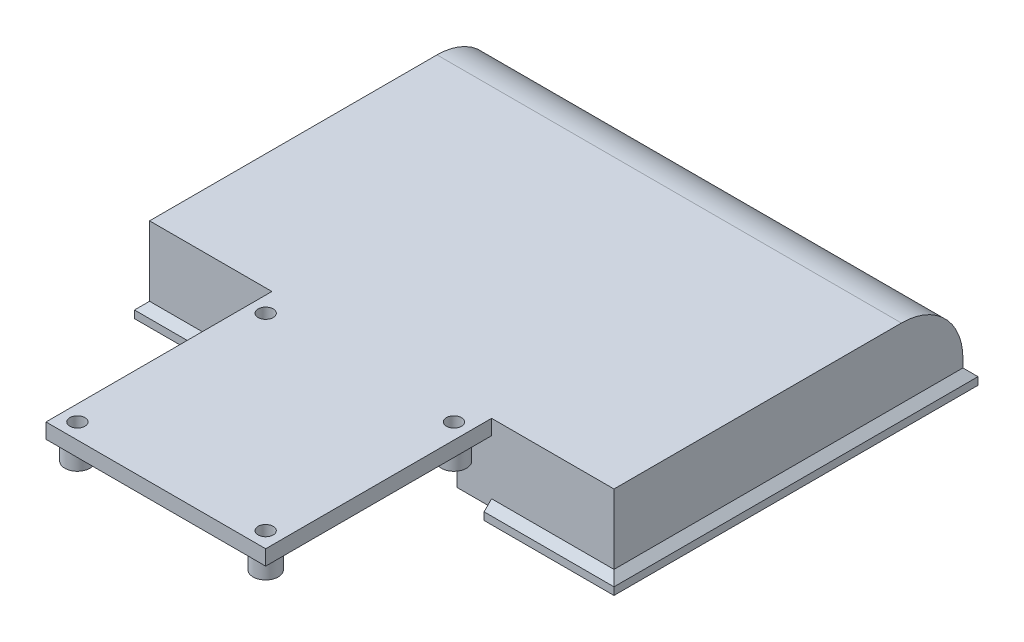
from build123d import *

# Parameters (mm, degrees)
BODY_DEPTH              = 70.053212
BODY_DEPTH_BACK         = 3.946788
SHELL1_T                = -1.2
SKETCH7_W               = 74
SKETCH7_H               = 1.6
BACK_WALL_DEPTH         = 12.3
SKETCH8_W               = 35
SKETCH8_H               = 2.4
FAN_MOUNT_DEPTH         = 36
SKETCH12_R              = 2
FAN_BOSS_DEPTH          = 3
M2_CLEARANCE_HOLE2_D    = 2.4
EDGE_START              = -2
EDGE_FLANGE_OUTLINE_W   = 76.399999565
EDGE_FLANGE_OUTLINE_H   = 58
EDGE_FLANGE_OUTLINE_W_2 = 74
EDGE_FLANGE_OUTLINE_H_2 = 55.6
EDGE_FLANGE_DEPTH       = 3.2
CHAMFER1_SIZE           = 2
SKETCH18_W              = 74.39999908
SKETCH18_H              = 56
BOX_RECESS_DEPTH        = 1.2
FAN_OPENING_REACH       = 93.419
SKETCH15_W              = 24
SKETCH15_H              = 8
SKETCH19_W              = 35
SKETCH19_H              = 2.4
FAN_RELIEF_DEPTH        = 92.419014649
AIR_CHANNEL_REACH       = 362.234
SKETCH20_W              = 6
SKETCH20_H              = 2.4
CLIP_RELIEF_DEPTH       = 1.6
LPATTERN2_COUNT         = 3
LPATTERN2_PITCH         = 21.6


# Read off the part's stored shape, not the designer's step: edge flange
with BuildPart() as part:
    # Sketch1 → body (new, two sides: drawn at the far end of the back side and taken through both)
    with BuildSketch(Plane(origin=(0, 0, 0), x_dir=(0, 0, -1), z_dir=(1, 0, 0)).offset(-BODY_DEPTH_BACK)):
        with BuildLine():
            Line((-316.902840602, -4.939561402), (-261.302840602, -4.939561402))
            Line((-261.302840602, -4.939561402), (-261.302840602, -2.439561402))
            ThreePointArc((-261.302840602, -2.439561402), (-264.173194146, 4.490085054), (-271.102840602, 7.360438598))
            Line((-271.102840602, 7.360438598), (-316.902840602, 7.360438598))
            Line((-316.902840602, 7.360438598), (-316.902840602, -4.939561402))
        make_face()
    extrude(amount=BODY_DEPTH + BODY_DEPTH_BACK)

    # Shell1
    shell1_openings = [part.faces().sort_by_distance(p)[0] for p in [
        (33.053212, -4.939561402, 289.102840602),
        (33.053212, 1.210438598, 316.902840602),
    ]]
    offset(amount=SHELL1_T, openings=shell1_openings, kind=Kind.INTERSECTION)

    # Sketch7 → back wall (add)
    with BuildSketch(Plane(origin=(0, -4.939561402, 0), x_dir=(1, 0, 0), z_dir=(0, 1, 0))):
        with Locations((33.053212174, -316.102840602)):
            Rectangle(SKETCH7_W, SKETCH7_H)
    extrude(amount=BACK_WALL_DEPTH)

    # Sketch8 → fan mount (add)
    with BuildSketch(Plane(origin=(0, 0, 316.902840602), x_dir=(-1, 0, 0), z_dir=(0, 0, -1))):
        with Locations((-33.053212174, 6.160438598)):
            Rectangle(SKETCH8_W, SKETCH8_H)
    extrude(amount=-FAN_MOUNT_DEPTH)

    # Sketch12 → fan boss (add)
    with BuildSketch(Plane.XZ.offset(-4.960438598)):
        with Locations((18.053212174, 350.402840602)):
            Circle(SKETCH12_R)
        with Locations(Location((18.053212174, 320.402840602, 0), (0, 0, 180))):
            Circle(SKETCH12_R)
        with Locations(Location((48.053212174, 350.402840602, 0), (0, 0, 180))):
            Circle(SKETCH12_R)
        with Locations((48.053212174, 320.402840602)):
            Circle(SKETCH12_R)
    extrude(amount=FAN_BOSS_DEPTH)

    # M2 Clearance Hole2 (through all)
    with Locations(Plane(origin=(0, 1.960438598, 0), x_dir=(-1, 0, 0), z_dir=(0, -1, 0))):
        with Locations((-18.053212174, -320.402840602), (-18.053212174, -350.402840602), (-48.053212174, -350.402840602), (-48.053212174, -320.402840602)):
            Hole(M2_CLEARANCE_HOLE2_D / 2)

    # edge flange outline → edge flange (add)
    with BuildSketch(Plane.XZ.offset(4.939561402).offset(EDGE_START)):
        with Locations((33.053211957, 289.102840602)):
            Rectangle(EDGE_FLANGE_OUTLINE_W, EDGE_FLANGE_OUTLINE_H)
        with Locations((33.053212174, 289.102840602)):
            Rectangle(EDGE_FLANGE_OUTLINE_W_2, EDGE_FLANGE_OUTLINE_H_2, mode=Mode.SUBTRACT)
    extrude(amount=EDGE_FLANGE_DEPTH)

    # Chamfer1
    # the kernel refuses this chamfer: 2 mm, written as the material it takes off along each edge
    with BuildSketch(Plane(origin=(76.396577715, -2.939561402, 318.102840602), x_dir=(0, 0.027495876610586605, -0.9996219169112968), z_dir=(-1, 0, 0))) as chamfer1_piece_1_section:
        Polygon((CHAMFER1_SIZE * 0.999621916911, CHAMFER1_SIZE * 0.0274958766106), (-CHAMFER1_SIZE * 0.0274958766106, CHAMFER1_SIZE * 0.999621916911), (0, 0), align=None)
    chamfer1_piece_1 = extrude(amount=86.686731517, mode=Mode.PRIVATE)
    chamfer1_piece_1 = split(chamfer1_piece_1, bisect_by=Plane(origin=(70.053212, -3.160856778, 316.605391079), z_dir=(1, 0, 0)), keep=Keep.TOP, mode=Mode.PRIVATE)
    chamfer1_piece_1 = split(chamfer1_piece_1, bisect_by=Plane(origin=(73.224894857, -3.160856778, 316.902840602), z_dir=(0, 0, -1)), keep=Keep.TOP, mode=Mode.PRIVATE)
    add(chamfer1_piece_1, mode=Mode.SUBTRACT)
    with BuildSketch(Plane(origin=(76.396577715, -2.939561402, 318.102840602), x_dir=(0, 0.027495876610586605, -0.9996219169112968), z_dir=(-1, 0, 0))) as chamfer1_piece_2_section:
        Polygon((CHAMFER1_SIZE * 0.999621916911, CHAMFER1_SIZE * 0.0274958766106), (-CHAMFER1_SIZE * 0.0274958766106, CHAMFER1_SIZE * 0.999621916911), (0, 0), align=None)
    chamfer1_piece_2 = extrude(amount=86.686731517, mode=Mode.PRIVATE)
    chamfer1_piece_2 = split(chamfer1_piece_2, bisect_by=Plane(origin=(70.053212, -3.689580321, 317.616127372), z_dir=(1, 0, 0)), keep=Keep.TOP, mode=Mode.PRIVATE)
    chamfer1_piece_2 = split(chamfer1_piece_2, bisect_by=Plane(origin=(73.224894857, -3.689580321, 316.902840602), z_dir=(0, 0, 1)), keep=Keep.TOP, mode=Mode.PRIVATE)
    add(chamfer1_piece_2, mode=Mode.SUBTRACT)
    with BuildSketch(Plane(origin=(76.396577715, -2.939561402, 318.102840602), x_dir=(0, 0.027495876610586605, -0.9996219169112968), z_dir=(-1, 0, 0))) as chamfer1_piece_3_section:
        Polygon((CHAMFER1_SIZE * 0.999621916911, CHAMFER1_SIZE * 0.0274958766106), (-CHAMFER1_SIZE * 0.0274958766106, CHAMFER1_SIZE * 0.999621916911), (0, 0), align=None)
    chamfer1_piece_3 = extrude(amount=86.686731517, mode=Mode.PRIVATE)
    chamfer1_piece_3 = split(chamfer1_piece_3, bisect_by=Plane(origin=(70.053212, -3.689580321, 317.616127372), z_dir=(-1, 0, 0)), keep=Keep.TOP, mode=Mode.PRIVATE)
    chamfer1_piece_3 = split(chamfer1_piece_3, bisect_by=Plane(origin=(-3.946788, -3.689580321, 317.616127372), z_dir=(1, 0, 0)), keep=Keep.TOP, mode=Mode.PRIVATE)
    chamfer1_piece_3 = split(chamfer1_piece_3, bisect_by=Plane(origin=(33.053212, -3.689580321, 316.902840602), z_dir=(0, 0, 1)), keep=Keep.TOP, mode=Mode.PRIVATE)
    add(chamfer1_piece_3, mode=Mode.SUBTRACT)
    with BuildSketch(Plane(origin=(76.396577715, -2.939561402, 318.102840602), x_dir=(0, 0.027495876610586605, -0.9996219169112968), z_dir=(-1, 0, 0))) as chamfer1_piece_4_section:
        Polygon((CHAMFER1_SIZE * 0.999621916911, CHAMFER1_SIZE * 0.0274958766106), (-CHAMFER1_SIZE * 0.0274958766106, CHAMFER1_SIZE * 0.999621916911), (0, 0), align=None)
    chamfer1_piece_4 = extrude(amount=86.686731517, mode=Mode.PRIVATE)
    chamfer1_piece_4 = split(chamfer1_piece_4, bisect_by=Plane(origin=(-3.946788, -3.160856778, 316.605391079), z_dir=(-1, 0, 0)), keep=Keep.TOP, mode=Mode.PRIVATE)
    chamfer1_piece_4 = split(chamfer1_piece_4, bisect_by=Plane(origin=(-7.118470901, -3.160856778, 316.902840602), z_dir=(0, 0, -1)), keep=Keep.TOP, mode=Mode.PRIVATE)
    add(chamfer1_piece_4, mode=Mode.SUBTRACT)
    with BuildSketch(Plane(origin=(76.396577715, -2.939561402, 318.102840602), x_dir=(0, 0.027495876610586605, -0.9996219169112968), z_dir=(-1, 0, 0))) as chamfer1_piece_5_section:
        Polygon((CHAMFER1_SIZE * 0.999621916911, CHAMFER1_SIZE * 0.0274958766106), (-CHAMFER1_SIZE * 0.0274958766106, CHAMFER1_SIZE * 0.999621916911), (0, 0), align=None)
    chamfer1_piece_5 = extrude(amount=86.686731517, mode=Mode.PRIVATE)
    chamfer1_piece_5 = split(chamfer1_piece_5, bisect_by=Plane(origin=(-3.946788, -3.689580321, 317.616127372), z_dir=(-1, 0, 0)), keep=Keep.TOP, mode=Mode.PRIVATE)
    chamfer1_piece_5 = split(chamfer1_piece_5, bisect_by=Plane(origin=(-7.118470901, -3.689580321, 316.902840602), z_dir=(0, 0, 1)), keep=Keep.TOP, mode=Mode.PRIVATE)
    add(chamfer1_piece_5, mode=Mode.SUBTRACT)
    with BuildSketch(Plane(origin=(71.253211739, -2.939561402, 254.959474626), x_dir=(-0.9996219169112968, 0.0274958766105862, 0), z_dir=(0, 0, 1))) as chamfer1_piece_6_section:
        Polygon((CHAMFER1_SIZE * 0.999621916911, CHAMFER1_SIZE * 0.0274958766106), (-CHAMFER1_SIZE * 0.0274958766106, CHAMFER1_SIZE * 0.999621916911), (0, 0), align=None)
    chamfer1_piece_6 = extrude(amount=68.286731952, mode=Mode.PRIVATE)
    chamfer1_piece_6 = split(chamfer1_piece_6, bisect_by=Plane(origin=(70.053212, -3.160856869, 258.131157614), z_dir=(-1, 0, 0)), keep=Keep.TOP, mode=Mode.PRIVATE)
    chamfer1_piece_6 = split(chamfer1_piece_6, bisect_by=Plane(origin=(69.75576239, -3.160856869, 261.302840602), z_dir=(0, 0, -1)), keep=Keep.TOP, mode=Mode.PRIVATE)
    add(chamfer1_piece_6, mode=Mode.SUBTRACT)
    with BuildSketch(Plane(origin=(71.253211739, -2.939561402, 254.959474626), x_dir=(-0.9996219169112968, 0.0274958766105862, 0), z_dir=(0, 0, 1))) as chamfer1_piece_7_section:
        Polygon((CHAMFER1_SIZE * 0.999621916911, CHAMFER1_SIZE * 0.0274958766106), (-CHAMFER1_SIZE * 0.0274958766106, CHAMFER1_SIZE * 0.999621916911), (0, 0), align=None)
    chamfer1_piece_7 = extrude(amount=68.286731952, mode=Mode.PRIVATE)
    chamfer1_piece_7 = split(chamfer1_piece_7, bisect_by=Plane(origin=(70.053212, -3.689580366, 258.131157614), z_dir=(1, 0, 0)), keep=Keep.TOP, mode=Mode.PRIVATE)
    chamfer1_piece_7 = split(chamfer1_piece_7, bisect_by=Plane(origin=(70.766498595, -3.689580366, 261.302840602), z_dir=(0, 0, -1)), keep=Keep.TOP, mode=Mode.PRIVATE)
    add(chamfer1_piece_7, mode=Mode.SUBTRACT)
    with BuildSketch(Plane(origin=(71.253211739, -2.939561402, 254.959474626), x_dir=(-0.9996219169112968, 0.0274958766105862, 0), z_dir=(0, 0, 1))) as chamfer1_piece_8_section:
        Polygon((CHAMFER1_SIZE * 0.999621916911, CHAMFER1_SIZE * 0.0274958766106), (-CHAMFER1_SIZE * 0.0274958766106, CHAMFER1_SIZE * 0.999621916911), (0, 0), align=None)
    chamfer1_piece_8 = extrude(amount=68.286731952, mode=Mode.PRIVATE)
    chamfer1_piece_8 = split(chamfer1_piece_8, bisect_by=Plane(origin=(70.053212, -3.689580366, 289.102840602), z_dir=(1, 0, 0)), keep=Keep.TOP, mode=Mode.PRIVATE)
    chamfer1_piece_8 = split(chamfer1_piece_8, bisect_by=Plane(origin=(70.766498595, -3.689580366, 316.902840602), z_dir=(0, 0, -1)), keep=Keep.TOP, mode=Mode.PRIVATE)
    chamfer1_piece_8 = split(chamfer1_piece_8, bisect_by=Plane(origin=(70.766498595, -3.689580366, 261.302840602), z_dir=(0, 0, 1)), keep=Keep.TOP, mode=Mode.PRIVATE)
    add(chamfer1_piece_8, mode=Mode.SUBTRACT)
    with BuildSketch(Plane(origin=(71.253211739, -2.939561402, 254.959474626), x_dir=(-0.9996219169112968, 0.0274958766105862, 0), z_dir=(0, 0, 1))) as chamfer1_piece_9_section:
        Polygon((CHAMFER1_SIZE * 0.999621916911, CHAMFER1_SIZE * 0.0274958766106), (-CHAMFER1_SIZE * 0.0274958766106, CHAMFER1_SIZE * 0.999621916911), (0, 0), align=None)
    chamfer1_piece_9 = extrude(amount=68.286731952, mode=Mode.PRIVATE)
    chamfer1_piece_9 = split(chamfer1_piece_9, bisect_by=Plane(origin=(70.053212, -3.160856869, 320.07452359), z_dir=(-1, 0, 0)), keep=Keep.TOP, mode=Mode.PRIVATE)
    chamfer1_piece_9 = split(chamfer1_piece_9, bisect_by=Plane(origin=(69.75576239, -3.160856869, 316.902840602), z_dir=(0, 0, 1)), keep=Keep.TOP, mode=Mode.PRIVATE)
    add(chamfer1_piece_9, mode=Mode.SUBTRACT)
    with BuildSketch(Plane(origin=(71.253211739, -2.939561402, 254.959474626), x_dir=(-0.9996219169112968, 0.0274958766105862, 0), z_dir=(0, 0, 1))) as chamfer1_piece_10_section:
        Polygon((CHAMFER1_SIZE * 0.999621916911, CHAMFER1_SIZE * 0.0274958766106), (-CHAMFER1_SIZE * 0.0274958766106, CHAMFER1_SIZE * 0.999621916911), (0, 0), align=None)
    chamfer1_piece_10 = extrude(amount=68.286731952, mode=Mode.PRIVATE)
    chamfer1_piece_10 = split(chamfer1_piece_10, bisect_by=Plane(origin=(70.053212, -3.689580366, 320.07452359), z_dir=(1, 0, 0)), keep=Keep.TOP, mode=Mode.PRIVATE)
    chamfer1_piece_10 = split(chamfer1_piece_10, bisect_by=Plane(origin=(70.766498595, -3.689580366, 316.902840602), z_dir=(0, 0, 1)), keep=Keep.TOP, mode=Mode.PRIVATE)
    add(chamfer1_piece_10, mode=Mode.SUBTRACT)
    with BuildSketch(Plane(origin=(-10.290153802, -2.939561402, 260.102840602), x_dir=(0, 0.027495876610586174, 0.9996219169112968), z_dir=(1, 0, 0))) as chamfer1_piece_11_section:
        Polygon((CHAMFER1_SIZE * 0.999621916911, CHAMFER1_SIZE * 0.0274958766106), (-CHAMFER1_SIZE * 0.0274958766106, CHAMFER1_SIZE * 0.999621916911), (0, 0), align=None)
    chamfer1_piece_11 = extrude(amount=86.686731517, mode=Mode.PRIVATE)
    chamfer1_piece_11 = split(chamfer1_piece_11, bisect_by=Plane(origin=(-3.946788, -3.160856778, 261.600290125), z_dir=(-1, 0, 0)), keep=Keep.TOP, mode=Mode.PRIVATE)
    chamfer1_piece_11 = split(chamfer1_piece_11, bisect_by=Plane(origin=(-7.118470901, -3.160856778, 261.302840602), z_dir=(0, 0, 1)), keep=Keep.TOP, mode=Mode.PRIVATE)
    add(chamfer1_piece_11, mode=Mode.SUBTRACT)
    with BuildSketch(Plane(origin=(-10.290153802, -2.939561402, 260.102840602), x_dir=(0, 0.027495876610586174, 0.9996219169112968), z_dir=(1, 0, 0))) as chamfer1_piece_12_section:
        Polygon((CHAMFER1_SIZE * 0.999621916911, CHAMFER1_SIZE * 0.0274958766106), (-CHAMFER1_SIZE * 0.0274958766106, CHAMFER1_SIZE * 0.999621916911), (0, 0), align=None)
    chamfer1_piece_12 = extrude(amount=86.686731517, mode=Mode.PRIVATE)
    chamfer1_piece_12 = split(chamfer1_piece_12, bisect_by=Plane(origin=(-3.946788, -3.689580321, 260.589553832), z_dir=(-1, 0, 0)), keep=Keep.TOP, mode=Mode.PRIVATE)
    chamfer1_piece_12 = split(chamfer1_piece_12, bisect_by=Plane(origin=(-7.118470901, -3.689580321, 261.302840602), z_dir=(0, 0, -1)), keep=Keep.TOP, mode=Mode.PRIVATE)
    add(chamfer1_piece_12, mode=Mode.SUBTRACT)
    with BuildSketch(Plane(origin=(-10.290153802, -2.939561402, 260.102840602), x_dir=(0, 0.027495876610586174, 0.9996219169112968), z_dir=(1, 0, 0))) as chamfer1_piece_13_section:
        Polygon((CHAMFER1_SIZE * 0.999621916911, CHAMFER1_SIZE * 0.0274958766106), (-CHAMFER1_SIZE * 0.0274958766106, CHAMFER1_SIZE * 0.999621916911), (0, 0), align=None)
    chamfer1_piece_13 = extrude(amount=86.686731517, mode=Mode.PRIVATE)
    chamfer1_piece_13 = split(chamfer1_piece_13, bisect_by=Plane(origin=(70.053212, -3.689580321, 260.589553832), z_dir=(-1, 0, 0)), keep=Keep.TOP, mode=Mode.PRIVATE)
    chamfer1_piece_13 = split(chamfer1_piece_13, bisect_by=Plane(origin=(-3.946788, -3.689580321, 260.589553832), z_dir=(1, 0, 0)), keep=Keep.TOP, mode=Mode.PRIVATE)
    chamfer1_piece_13 = split(chamfer1_piece_13, bisect_by=Plane(origin=(33.053212, -3.689580321, 261.302840602), z_dir=(0, 0, -1)), keep=Keep.TOP, mode=Mode.PRIVATE)
    add(chamfer1_piece_13, mode=Mode.SUBTRACT)
    with BuildSketch(Plane(origin=(-10.290153802, -2.939561402, 260.102840602), x_dir=(0, 0.027495876610586174, 0.9996219169112968), z_dir=(1, 0, 0))) as chamfer1_piece_14_section:
        Polygon((CHAMFER1_SIZE * 0.999621916911, CHAMFER1_SIZE * 0.0274958766106), (-CHAMFER1_SIZE * 0.0274958766106, CHAMFER1_SIZE * 0.999621916911), (0, 0), align=None)
    chamfer1_piece_14 = extrude(amount=86.686731517, mode=Mode.PRIVATE)
    chamfer1_piece_14 = split(chamfer1_piece_14, bisect_by=Plane(origin=(70.053212, -3.160856778, 261.600290125), z_dir=(1, 0, 0)), keep=Keep.TOP, mode=Mode.PRIVATE)
    chamfer1_piece_14 = split(chamfer1_piece_14, bisect_by=Plane(origin=(73.224894857, -3.160856778, 261.302840602), z_dir=(0, 0, 1)), keep=Keep.TOP, mode=Mode.PRIVATE)
    add(chamfer1_piece_14, mode=Mode.SUBTRACT)
    with BuildSketch(Plane(origin=(-10.290153802, -2.939561402, 260.102840602), x_dir=(0, 0.027495876610586174, 0.9996219169112968), z_dir=(1, 0, 0))) as chamfer1_piece_15_section:
        Polygon((CHAMFER1_SIZE * 0.999621916911, CHAMFER1_SIZE * 0.0274958766106), (-CHAMFER1_SIZE * 0.0274958766106, CHAMFER1_SIZE * 0.999621916911), (0, 0), align=None)
    chamfer1_piece_15 = extrude(amount=86.686731517, mode=Mode.PRIVATE)
    chamfer1_piece_15 = split(chamfer1_piece_15, bisect_by=Plane(origin=(70.053212, -3.689580321, 260.589553832), z_dir=(1, 0, 0)), keep=Keep.TOP, mode=Mode.PRIVATE)
    chamfer1_piece_15 = split(chamfer1_piece_15, bisect_by=Plane(origin=(73.224894857, -3.689580321, 261.302840602), z_dir=(0, 0, -1)), keep=Keep.TOP, mode=Mode.PRIVATE)
    add(chamfer1_piece_15, mode=Mode.SUBTRACT)
    with BuildSketch(Plane(origin=(-5.146787826, -2.939561402, 323.246206578), x_dir=(0.9996219169112968, 0.027495876610586275, 0), z_dir=(0, 0, -1))) as chamfer1_piece_16_section:
        Polygon((CHAMFER1_SIZE * 0.999621916911, CHAMFER1_SIZE * 0.0274958766106), (-CHAMFER1_SIZE * 0.0274958766106, CHAMFER1_SIZE * 0.999621916911), (0, 0), align=None)
    chamfer1_piece_16 = extrude(amount=68.286731952, mode=Mode.PRIVATE)
    chamfer1_piece_16 = split(chamfer1_piece_16, bisect_by=Plane(origin=(-3.946788, -3.160856839, 320.07452359), z_dir=(1, 0, 0)), keep=Keep.TOP, mode=Mode.PRIVATE)
    chamfer1_piece_16 = split(chamfer1_piece_16, bisect_by=Plane(origin=(-3.649338419, -3.160856839, 316.902840602), z_dir=(0, 0, 1)), keep=Keep.TOP, mode=Mode.PRIVATE)
    add(chamfer1_piece_16, mode=Mode.SUBTRACT)
    with BuildSketch(Plane(origin=(-5.146787826, -2.939561402, 323.246206578), x_dir=(0.9996219169112968, 0.027495876610586275, 0), z_dir=(0, 0, -1))) as chamfer1_piece_17_section:
        Polygon((CHAMFER1_SIZE * 0.999621916911, CHAMFER1_SIZE * 0.0274958766106), (-CHAMFER1_SIZE * 0.0274958766106, CHAMFER1_SIZE * 0.999621916911), (0, 0), align=None)
    chamfer1_piece_17 = extrude(amount=68.286731952, mode=Mode.PRIVATE)
    chamfer1_piece_17 = split(chamfer1_piece_17, bisect_by=Plane(origin=(-3.946788, -3.689580351, 320.07452359), z_dir=(-1, 0, 0)), keep=Keep.TOP, mode=Mode.PRIVATE)
    chamfer1_piece_17 = split(chamfer1_piece_17, bisect_by=Plane(origin=(-4.660074654, -3.689580351, 316.902840602), z_dir=(0, 0, 1)), keep=Keep.TOP, mode=Mode.PRIVATE)
    add(chamfer1_piece_17, mode=Mode.SUBTRACT)
    with BuildSketch(Plane(origin=(-5.146787826, -2.939561402, 323.246206578), x_dir=(0.9996219169112968, 0.027495876610586275, 0), z_dir=(0, 0, -1))) as chamfer1_piece_18_section:
        Polygon((CHAMFER1_SIZE * 0.999621916911, CHAMFER1_SIZE * 0.0274958766106), (-CHAMFER1_SIZE * 0.0274958766106, CHAMFER1_SIZE * 0.999621916911), (0, 0), align=None)
    chamfer1_piece_18 = extrude(amount=68.286731952, mode=Mode.PRIVATE)
    chamfer1_piece_18 = split(chamfer1_piece_18, bisect_by=Plane(origin=(-3.946788, -3.689580351, 289.102840602), z_dir=(-1, 0, 0)), keep=Keep.TOP, mode=Mode.PRIVATE)
    chamfer1_piece_18 = split(chamfer1_piece_18, bisect_by=Plane(origin=(-4.660074654, -3.689580351, 316.902840602), z_dir=(0, 0, -1)), keep=Keep.TOP, mode=Mode.PRIVATE)
    chamfer1_piece_18 = split(chamfer1_piece_18, bisect_by=Plane(origin=(-4.660074654, -3.689580351, 261.302840602), z_dir=(0, 0, 1)), keep=Keep.TOP, mode=Mode.PRIVATE)
    add(chamfer1_piece_18, mode=Mode.SUBTRACT)
    with BuildSketch(Plane(origin=(-5.146787826, -2.939561402, 323.246206578), x_dir=(0.9996219169112968, 0.027495876610586275, 0), z_dir=(0, 0, -1))) as chamfer1_piece_19_section:
        Polygon((CHAMFER1_SIZE * 0.999621916911, CHAMFER1_SIZE * 0.0274958766106), (-CHAMFER1_SIZE * 0.0274958766106, CHAMFER1_SIZE * 0.999621916911), (0, 0), align=None)
    chamfer1_piece_19 = extrude(amount=68.286731952, mode=Mode.PRIVATE)
    chamfer1_piece_19 = split(chamfer1_piece_19, bisect_by=Plane(origin=(-3.946788, -3.160856839, 258.131157614), z_dir=(1, 0, 0)), keep=Keep.TOP, mode=Mode.PRIVATE)
    chamfer1_piece_19 = split(chamfer1_piece_19, bisect_by=Plane(origin=(-3.649338419, -3.160856839, 261.302840602), z_dir=(0, 0, -1)), keep=Keep.TOP, mode=Mode.PRIVATE)
    add(chamfer1_piece_19, mode=Mode.SUBTRACT)
    with BuildSketch(Plane(origin=(-5.146787826, -2.939561402, 323.246206578), x_dir=(0.9996219169112968, 0.027495876610586275, 0), z_dir=(0, 0, -1))) as chamfer1_piece_20_section:
        Polygon((CHAMFER1_SIZE * 0.999621916911, CHAMFER1_SIZE * 0.0274958766106), (-CHAMFER1_SIZE * 0.0274958766106, CHAMFER1_SIZE * 0.999621916911), (0, 0), align=None)
    chamfer1_piece_20 = extrude(amount=68.286731952, mode=Mode.PRIVATE)
    chamfer1_piece_20 = split(chamfer1_piece_20, bisect_by=Plane(origin=(-3.946788, -3.689580351, 258.131157614), z_dir=(-1, 0, 0)), keep=Keep.TOP, mode=Mode.PRIVATE)
    chamfer1_piece_20 = split(chamfer1_piece_20, bisect_by=Plane(origin=(-4.660074654, -3.689580351, 261.302840602), z_dir=(0, 0, -1)), keep=Keep.TOP, mode=Mode.PRIVATE)
    add(chamfer1_piece_20, mode=Mode.SUBTRACT)

    # Sketch18 → box recess (cut)
    with BuildSketch(Plane(origin=(0, -6.139561402, 0), x_dir=(-1, 0, 0), z_dir=(0, -1, 0))):
        with Locations((-33.053212726, -289.102840602)):
            Rectangle(SKETCH18_W, SKETCH18_H)
    extrude(amount=-BOX_RECESS_DEPTH, mode=Mode.SUBTRACT)

    # Sketch15 → fan opening (cut, up to next)
    with BuildSketch(Plane.XY.offset(316.902840602), mode=Mode.PRIVATE) as fan_opening_sk1:
        with Locations((33.053212174, -0.939561402)):
            Rectangle(SKETCH15_W, SKETCH15_H)
    fan_opening_tool1 = extrude(fan_opening_sk1.sketch, amount=-FAN_OPENING_REACH, mode=Mode.PRIVATE) & part.part
    add(fan_opening_tool1.solids().sort_by_distance((33.053212, -0.939561, 316.902841))[0], mode=Mode.SUBTRACT)

    # Sketch19 → fan relief (cut, through all)
    with BuildSketch(Plane.XY.offset(316.902840602)):
        with Locations((33.053212174, -4.939561402)):
            Rectangle(SKETCH19_W, SKETCH19_H)
    extrude(amount=FAN_RELIEF_DEPTH, mode=Mode.SUBTRACT)

    # Sketch16 → air channel (add, up to next)
    with BuildSketch(Plane.XZ.offset(4.939561402), mode=Mode.PRIVATE) as air_channel_sk1:
        with BuildLine():
            Line((62.453212174, 261.102840602), (62.453212174, 291.102840602))
            ThreePointArc((62.453212174, 291.102840602), (54.653212174, 298.902840602), (46.853212174, 291.102840602))
            Line((46.853212174, 291.102840602), (46.853212174, 261.102840602))
            Line((46.853212174, 261.102840602), (62.453212174, 261.102840602))
        make_face()
        with BuildLine():
            Line((48.053212174, 262.302840602), (61.253212174, 262.302840602))
            Line((61.253212174, 262.302840602), (61.253212174, 291.102840602))
            ThreePointArc((61.253212174, 291.102840602), (54.653212174, 297.702840602), (48.053212174, 291.102840602))
            Line((48.053212174, 291.102840602), (48.053212174, 262.302840602))
        make_face(mode=Mode.SUBTRACT)
    air_channel_tool1 = extrude(air_channel_sk1.sketch, amount=-AIR_CHANNEL_REACH, mode=Mode.PRIVATE) - part.part
    air_channel = air_channel_tool1.solids().sort_by_distance((47.262138, -4.939561, 276.102841))[0]
    add(air_channel)

    # Sketch20 → clip relief (cut)
    with BuildSketch(Plane.XZ.offset(6.139561402)):
        with Locations((52.353212174, 261.302840602)):
            Rectangle(SKETCH20_W, SKETCH20_H)
    clip_relief = extrude(amount=-CLIP_RELIEF_DEPTH, mode=Mode.SUBTRACT)

    # LPattern2: air channel, clip relief ×3
    with Locations(*[(-i * LPATTERN2_PITCH, 0, 0) for i in range(1, LPATTERN2_COUNT)]):
        add(air_channel)
        add(clip_relief, mode=Mode.SUBTRACT)


solid = part.part
